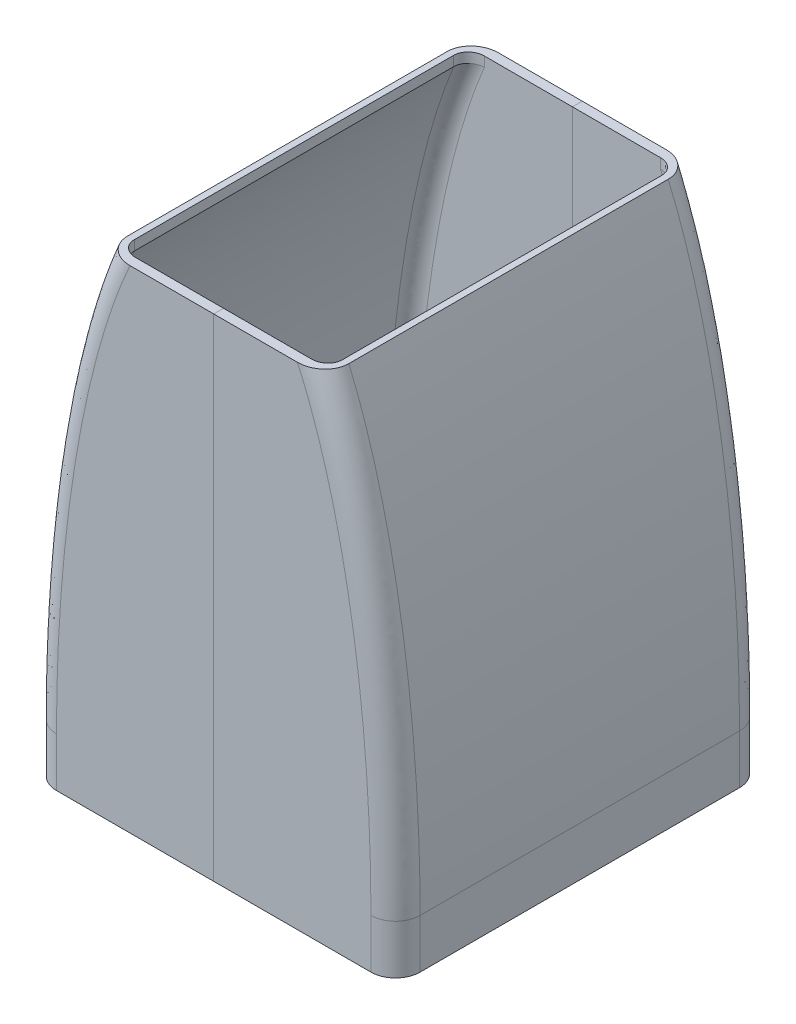
from build123d import *

# Parameters (mm, degrees)
BOSS_EXTRUDE1_DEPTH      = 37.5
BOSS_EXTRUDE1_DEPTH_BACK = 37.5
FILLET1_R                = 5
SHELL1_T                 = -2
CUT_EXTRUDE1_REACH       = 113.262


with BuildPart() as part:
    # Sketch1 → Boss-Extrude1 (new, two sides: drawn at the far end of the back side and taken through both)
    with BuildSketch(Plane.XY.offset(-BOSS_EXTRUDE1_DEPTH_BACK)):
        with BuildLine():
            Line((37, 0), (-37, 0))
            Line((-37, 0), (-37, 10))
            add(Edge.make_bspline(
                [(-22.5, 100), (-37, 65.966386555), (-37, 10)],
                knots=[3.79526789, 3.79526789, 3.79526789, 4.71238898, 4.71238898, 4.71238898], degree=2, weights=[1, 0.896690612, 1]))
            Line((-22.5, 100), (22.5, 100))
            add(Edge.make_bspline(
                [(37, 10), (37, 65.966386555), (22.5, 100)],
                knots=[1.570796327, 1.570796327, 1.570796327, 2.487917417, 2.487917417, 2.487917417], degree=2, weights=[1, 0.896690612, 1]))
            Line((37, 10), (37, 0))
        make_face()
    extrude(amount=BOSS_EXTRUDE1_DEPTH + BOSS_EXTRUDE1_DEPTH_BACK)

    # Fillet1
    fillet1_edges = [part.edges().sort_by_distance(p)[0] for p in [
        (37, 5, 37.5),
        (33.860085141, 55.70458779, 37.5),
        (37, 5, -37.5),
        (33.860085141, 55.70458779, -37.5),
        (-37, 5, -37.5),
        (-33.860085227, 55.704587194, -37.5),
        (-37, 5, 37.5),
        (-33.860085227, 55.704587194, 37.5),
    ]]
    fillet(fillet1_edges, radius=FILLET1_R)

    # Shell1
    shell1_openings = [part.faces().sort_by_distance(p)[0] for p in [
        (0, 0, 0),
    ]]
    offset(amount=SHELL1_T, openings=shell1_openings)

    # Sketch2 → Cut-Extrude1 (cut, up to next)
    with BuildSketch(Plane.XZ.offset(-98), mode=Mode.PRIVATE) as cut_extrude1_sk1:
        with BuildLine():
            Line((17.917205004, 35.5), (-17.917205004, 35.5))
            add(Edge.make_bspline(
                [(-17.917205004, 35.5), (-18.123412989, 35.5), (-18.327163302, 35.48215827), (-18.729821691, 35.411322073), (-18.930269793, 35.357591685), (-19.313994033, 35.216700254), (-19.498253911, 35.129680775), (-19.850877934, 34.920987297), (-20.018518895, 34.799198748), (-20.323623009, 34.528608095), (-20.463654307, 34.377847351), (-20.711171949, 34.049088217), (-20.816450349, 33.874453129), (-20.989335126, 33.504277251), (-21.056822063, 33.30715912), (-21.145879643, 32.909315892), (-21.168710347, 32.706635459), (-21.168710347, 32.5)],
                knots=[0, 0, 0, 0, 0.125, 0.125, 0.25, 0.25, 0.375, 0.375, 0.5, 0.5, 0.625, 0.625, 0.75, 0.75, 0.875, 0.875, 1, 1, 1, 1], degree=3))
            Line((-21.168710347, 32.5), (-21.168710347, -32.5))
            add(Edge.make_bspline(
                [(-21.168710347, -32.5), (-21.168710347, -32.706999872), (-21.145226344, -32.914166494), (-21.054902984, -33.313743908), (-20.988620942, -33.506216148), (-20.815082855, -33.87696651), (-20.707031432, -34.055162548), (-20.461572176, -34.380023321), (-20.323140092, -34.529243741), (-20.015426261, -34.801731761), (-19.84800292, -34.922828207), (-19.497772744, -35.129824811), (-19.313528203, -35.217005877), (-18.733408623, -35.42960165), (-18.330119615, -35.5), (-17.917205004, -35.5)],
                knots=[0, 0, 0, 0, 0.125, 0.125, 0.25, 0.25, 0.375, 0.375, 0.5, 0.5, 0.625, 0.625, 0.75, 0.75, 1, 1, 1, 1], degree=3))
            Line((-17.917205004, -35.5), (17.917205004, -35.5))
            add(Edge.make_bspline(
                [(17.917205004, -35.5), (18.123412989, -35.5), (18.327163302, -35.48215827), (18.729821691, -35.411322073), (18.930269793, -35.357591685), (19.313994033, -35.216700254), (19.498253911, -35.129680775), (19.850877934, -34.920987297), (20.018518895, -34.799198748), (20.323623009, -34.528608095), (20.463654307, -34.377847351), (20.711171949, -34.049088217), (20.816450349, -33.874453129), (20.989335126, -33.504277251), (21.056822063, -33.30715912), (21.145879643, -32.909315892), (21.168710347, -32.706635459), (21.168710347, -32.5)],
                knots=[0, 0, 0, 0, 0.125, 0.125, 0.25, 0.25, 0.375, 0.375, 0.5, 0.5, 0.625, 0.625, 0.75, 0.75, 0.875, 0.875, 1, 1, 1, 1], degree=3))
            Line((21.168710347, -32.5), (21.168710347, 32.5))
            add(Edge.make_bspline(
                [(21.168710347, 32.5), (21.168710347, 32.706999872), (21.145226344, 32.914166494), (21.054902984, 33.313743908), (20.988620942, 33.506216148), (20.815082855, 33.87696651), (20.707031432, 34.055162548), (20.461572176, 34.380023321), (20.323140092, 34.529243741), (20.015426261, 34.801731761), (19.84800292, 34.922828207), (19.497772744, 35.129824811), (19.313528203, 35.217005877), (18.733408623, 35.42960165), (18.330119615, 35.5), (17.917205004, 35.5)],
                knots=[0, 0, 0, 0, 0.125, 0.125, 0.25, 0.25, 0.375, 0.375, 0.5, 0.5, 0.625, 0.625, 0.75, 0.75, 1, 1, 1, 1], degree=3))
        make_face()
    cut_extrude1_tool1 = extrude(cut_extrude1_sk1.sketch, amount=-CUT_EXTRUDE1_REACH, mode=Mode.PRIVATE) & part.part
    add(cut_extrude1_tool1.solids().sort_by_distance((0, 98, -4.4e-05))[0], mode=Mode.SUBTRACT)


with BuildPart() as body_2:
    # Split1: the piece on the far side of the plane
    add(part.part)
    split(bisect_by=Plane(origin=(0, 0, 0), x_dir=(0, 0, 1), z_dir=(1, 0, 0)), keep=Keep.BOTTOM)


with BuildPart() as part_1:
    add(part.part)

    # Split1
    split(bisect_by=Plane(origin=(0, 0, 0), x_dir=(0, 0, 1), z_dir=(1, 0, 0)), keep=Keep.TOP)


solid = Compound([body_2.part, part_1.part])
